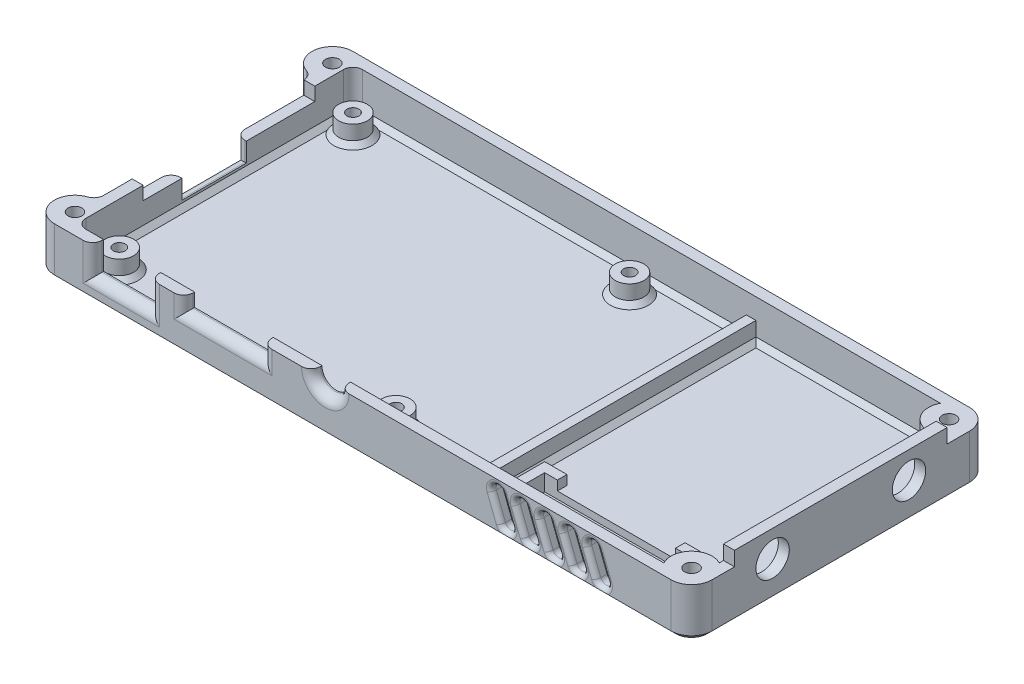
from build123d import *

# Parameters (mm, degrees)
SKETCH3_W                      = 133.6
SKETCH3_H                      = 62.6
SKETCH3_W_2                    = 129
SKETCH3_H_2                    = 58
BOSS_EXTRUDE1_DEPTH            = 10.3
SKETCH5_W                      = 129
SKETCH5_H                      = 58
BOSS_EXTRUDE2_DEPTH            = 2
SKETCH6_R                      = 3
BOSS_EXTRUDE3_DEPTH            = 4
F_2_5_2_5_DIAMETER_HOLE1_D     = 2.5
F_2_5_2_5_DIAMETER_HOLE1_DEPTH = 8
F_2_5_2_5_DIAMETER_HOLE1_TIP   = 0.751075774
SKETCH10_W                     = 2
SKETCH10_H                     = 58
BOSS_EXTRUDE4_DEPTH            = 4
CUT_EXTRUDE1_REACH             = 100.128
SKETCH11_R                     = 3
SKETCH11_W                     = 12
SKETCH11_H                     = 5.8
SKETCH11_W_2                   = 16.5
SKETCH11_H_2                   = 2.8
CUT_EXTRUDE2_REACH             = 140.343
SKETCH12_W                     = 13.5
SKETCH12_H                     = 6.8
SKETCH12_W_2                   = 36
SKETCH12_H_2                   = 2.8
FILLET6_R                      = 2
FILLET8_R                      = 2
CHAMFER1_SIZE                  = 1
FILLET9_R                      = 2
BOSS_EXTRUDE6_DEPTH            = 10.3
F_2_9_2_9_DIAMETER_HOLE2_D     = 2.9
F_2_9_2_9_DIAMETER_HOLE1_D     = 2.9
SKETCH24_R                     = 4.3
BOSS_EXTRUDE7_DEPTH            = 8.3
F_2_9_2_9_DIAMETER_HOLE5_D     = 2.9
F_2_9_2_9_DIAMETER_HOLE4_D     = 2.9
FILLET10_R                     = 4.3
FILLET18_R                     = 2
CHAMFER3_SIZE                  = 1
FILLET19_R                     = 2
FILLET20_R                     = 4.3
CHAMFER6_SIZE                  = 1
SKETCH29_W                     = 2.3
SKETCH29_H                     = 44.6
BOSS_EXTRUDE8_DEPTH            = 3
CUT_EXTRUDE3_REACH             = 166.847
SKETCH13_R                     = 3.5
SKETCH32_W                     = 30.1
SKETCH32_H                     = 10.2
CUT_EXTRUDE4_DEPTH             = 1.5
BOSS_EXTRUDE9_DEPTH            = 2
CUT_EXTRUDE5_REACH             = 103.795
FILLET21_R                     = 1
CHAMFER7_SIZE                  = 1


# Some blends are built 0.0001 mm under size
with BuildPart() as part:
    # Sketch3 → Boss-Extrude1 (new body)
    with BuildSketch(Plane(origin=(0, 0, 0), x_dir=(1, 0, 0), z_dir=(0, 1, 0))):
        with Locations((-8.061766162, 3.105993834)):
            Rectangle(SKETCH3_W, SKETCH3_H)
        with Locations((-8.061766162, 3.105993834)):
            Rectangle(SKETCH3_W_2, SKETCH3_H_2, mode=Mode.SUBTRACT)
    extrude(amount=BOSS_EXTRUDE1_DEPTH)

    # Sketch5 → Boss-Extrude2 (add)
    with BuildSketch(Plane(origin=(0, 0, 0), x_dir=(1, 0, 0), z_dir=(0, 1, 0))):
        with Locations((-8.061766162, 3.105993834)):
            Rectangle(SKETCH5_W, SKETCH5_H)
    extrude(amount=BOSS_EXTRUDE2_DEPTH)

    # Sketch6 → Boss-Extrude3 (add)
    with BuildSketch(Plane(origin=(0, 2, 0), x_dir=(1, 0, 0), z_dir=(0, 1, 0))):
        with Locations(Location((-68.061766162, 27.605993834, 0), (0, 0, 270))):
            Circle(SKETCH6_R)
        with Locations(Location((-68.061766162, -21.394006166, 0), (0, 0, 270))):
            Circle(SKETCH6_R)
        with Locations(Location((-10.061766162, -21.394006166, 0), (0, 0, 270))):
            Circle(SKETCH6_R)
        with Locations(Location((-10.061766162, 27.605993834, 0), (0, 0, 270))):
            Circle(SKETCH6_R)
    extrude(amount=BOSS_EXTRUDE3_DEPTH)

    # Ø2.5 (2.5) Diameter Hole1
    with Locations(Plane(origin=(0, 6, 0), x_dir=(1, 0, 0), z_dir=(0, 1, 0))):
        with Locations((-68.061766162, 27.605993834), (-10.061766162, 27.605993834), (-10.061766162, -21.394006166), (-68.061766162, -21.394006166)):
            Hole(F_2_5_2_5_DIAMETER_HOLE1_D / 2, depth=F_2_5_2_5_DIAMETER_HOLE1_DEPTH)
            with Locations((0, 0, -(F_2_5_2_5_DIAMETER_HOLE1_DEPTH + F_2_5_2_5_DIAMETER_HOLE1_TIP / 2))):  # 118° drill point
                Cone(0, F_2_5_2_5_DIAMETER_HOLE1_D / 2, F_2_5_2_5_DIAMETER_HOLE1_TIP, mode=Mode.SUBTRACT)

    # Sketch10 → Boss-Extrude4 (add)
    with BuildSketch(Plane(origin=(0, 2, 0), x_dir=(1, 0, 0), z_dir=(0, 1, 0))):
        with Locations((10.938233838, 3.105993834)):
            Rectangle(SKETCH10_W, SKETCH10_H)
    extrude(amount=BOSS_EXTRUDE4_DEPTH)

    # Sketch11 → Cut-Extrude1 (cut, up to next)
    with BuildSketch(Plane.XY.offset(28.194006166), mode=Mode.PRIVATE) as cut_extrude1_sk1:
        with Locations((-18.061766162, 10.3)):
            Circle(SKETCH11_R)
    cut_extrude1_tool1 = extrude(cut_extrude1_sk1.sketch, amount=-CUT_EXTRUDE1_REACH, mode=Mode.PRIVATE) & part.part
    # Sketch11 → Cut-Extrude1 (cut, up to next)
    with BuildSketch(Plane.XY.offset(28.194006166), mode=Mode.PRIVATE) as cut_extrude1_sk2:
        with Locations((-60.861766162, 7.4)):
            Rectangle(SKETCH11_W, SKETCH11_H)
    cut_extrude1_tool2 = extrude(cut_extrude1_sk2.sketch, amount=-CUT_EXTRUDE1_REACH, mode=Mode.PRIVATE) & part.part
    # Sketch11 → Cut-Extrude1 (cut, up to next)
    with BuildSketch(Plane.XY.offset(28.194006166), mode=Mode.PRIVATE) as cut_extrude1_sk3:
        with Locations((-39.527982648, 8.9)):
            Rectangle(SKETCH11_W_2, SKETCH11_H_2)
    cut_extrude1_tool3 = extrude(cut_extrude1_sk3.sketch, amount=-CUT_EXTRUDE1_REACH, mode=Mode.PRIVATE) & part.part
    add(cut_extrude1_tool1.solids().sort_by_distance((-18.061766, 10.3, 28.194006))[0], mode=Mode.SUBTRACT)
    add(cut_extrude1_tool2.solids().sort_by_distance((-60.861766, 7.4, 28.194006))[0], mode=Mode.SUBTRACT)
    add(cut_extrude1_tool3.solids().sort_by_distance((-39.527983, 8.9, 28.194006))[0], mode=Mode.SUBTRACT)

    # Sketch12 → Cut-Extrude2 (cut, up to next)
    with BuildSketch(Plane.ZY.offset(74.861766162), mode=Mode.PRIVATE) as cut_extrude2_sk1:
        with Locations((-2.982922372, 6.9)):
            Rectangle(SKETCH12_W, SKETCH12_H)
    cut_extrude2_tool1 = extrude(cut_extrude2_sk1.sketch, amount=-CUT_EXTRUDE2_REACH, mode=Mode.PRIVATE) & part.part
    # Sketch12 → Cut-Extrude2 (cut, up to next)
    with BuildSketch(Plane.ZY.offset(74.861766162), mode=Mode.PRIVATE) as cut_extrude2_sk2:
        with Locations((-6.105993834, 8.9)):
            Rectangle(SKETCH12_W_2, SKETCH12_H_2)
    cut_extrude2_tool2 = extrude(cut_extrude2_sk2.sketch, amount=-CUT_EXTRUDE2_REACH, mode=Mode.PRIVATE) & part.part
    add(cut_extrude2_tool1.solids().sort_by_distance((-74.861766, 6.9, -2.982922))[0], mode=Mode.SUBTRACT)
    add(cut_extrude2_tool2.solids().sort_by_distance((-74.861766, 8.9, -6.105994))[0], mode=Mode.SUBTRACT)

    # Fillet6
    fillet6_edges = [part.edges().sort_by_distance(p)[0] for p in [
        (56.438233838, 6.15, -32.105993834),
    ]]
    fillet(fillet6_edges, radius=FILLET6_R)

    # Fillet8
    fillet8_edges = [part.edges().sort_by_distance(p)[0] for p in [
        (-72.561766162, 6.15, -32.105993834),
        (-72.561766162, 6.15, 25.894006166),
    ]]
    fillet(fillet8_edges, radius=FILLET8_R)

    # Chamfer1
    chamfer1_edges = [part.edges().sort_by_distance(p)[0] for p in [
        (-68.061766162, 2, -30.605993834),
        (-68.061766162, 2, 18.394006166),
        (-10.061766162, 2, 18.394006166),
        (-10.061766162, 2, -30.605993834),
    ]]
    chamfer(chamfer1_edges, length=CHAMFER1_SIZE)

    # Fillet9
    fillet9_edges = [part.edges().sort_by_distance(p)[0] for p in [
        (-60.861766162, 4.5, 28.194006166),
        (-54.861766162, 7.4, 28.194006166),
        (-47.777982648, 8.9, 28.194006166),
        (-39.527982648, 7.5, 28.194006166),
        (-31.277982648, 8.9, 28.194006166),
        (-18.061766162, 7.3, 28.194006166),
        (-74.861766162, 5.5, -9.732922372),
        (-74.861766162, 3.5, -2.982922372),
        (-74.861766162, 5.5, 3.767077628),
    ]]
    fillet(fillet9_edges, radius=FILLET9_R)

    # Sketch17 → Boss-Extrude6 (add)
    with BuildSketch(Plane(origin=(0, 0, 0), x_dir=(1, 0, 0), z_dir=(0, 1, 0))):
        with BuildLine():
            Line((-74.861766162, 34.405993834), (-74.861766162, 25.805993834))
            ThreePointArc((-74.861766162, 25.805993834), (-79.161766162, 30.105993834), (-74.861766162, 34.405993834))
        make_face()
        with BuildLine():
            Line((-74.861766162, -19.594006166), (-74.861766162, -28.194006166))
            ThreePointArc((-74.861766162, -28.194006166), (-79.161766162, -23.894006166), (-74.861766162, -19.594006166))
        make_face()
    extrude(amount=BOSS_EXTRUDE6_DEPTH)

    # Ø2.9 (2.9) Diameter Hole2 (through all)
    with Locations(Plane(origin=(0, 10.3, 0), x_dir=(1, 0, 0), z_dir=(0, 1, 0))):
        with Locations((-74.861766162, 30.105993834)):
            Hole(F_2_9_2_9_DIAMETER_HOLE2_D / 2)

    # Ø2.9 (2.9) Diameter Hole1 (through all)
    with Locations(Plane(origin=(0, 10.3, 0), x_dir=(1, 0, 0), z_dir=(0, 1, 0))):
        with Locations((-74.861766162, -23.894006166)):
            Hole(F_2_9_2_9_DIAMETER_HOLE1_D / 2)

    # Sketch24 → Boss-Extrude7 (add)
    with BuildSketch(Plane(origin=(0, 2, 0), x_dir=(1, 0, 0), z_dir=(0, 1, 0))):
        with Locations((54.438233838, -23.894006166)):
            Circle(SKETCH24_R)
        with Locations((54.438233838, 30.105993834)):
            Circle(SKETCH24_R)
    extrude(amount=BOSS_EXTRUDE7_DEPTH)

    # Ø2.9 (2.9) Diameter Hole5 (through all)
    with Locations(Plane(origin=(0, 10.3, 0), x_dir=(1, 0, 0), z_dir=(0, 1, 0))):
        with Locations((54.438233838, -23.894006166)):
            Hole(F_2_9_2_9_DIAMETER_HOLE5_D / 2)

    # Ø2.9 (2.9) Diameter Hole4 (through all)
    with Locations(Plane(origin=(0, 10.3, 0), x_dir=(1, 0, 0), z_dir=(0, 1, 0))):
        with Locations((54.438233838, 30.105993834)):
            Hole(F_2_9_2_9_DIAMETER_HOLE4_D / 2)

    # Fillet10
    fillet10_edges = [part.edges().sort_by_distance(p)[0] for p in [
        (58.738233838, 5.15, -34.405993834),
    ]]
    fillet(fillet10_edges, radius=FILLET10_R - 0.0001)  # a hair under: the kernel refuses the full size

    # Fillet18
    fillet18_edges = [part.edges().sort_by_distance(p)[0] for p in [
        (-74.861766162, 5.15, -25.805993834),
        (-74.861766162, 5.15, 19.594006166),
    ]]
    fillet(fillet18_edges, radius=FILLET18_R)

    # Chamfer3
    chamfer3_edges = [part.edges().sort_by_distance(p)[0] for p in [
        (-79.105793795, 0, -30.797535193),
        (-10.211716162, 0, -34.405993834),
        (57.478822286, 0, -33.146582283),
        (-79.105793795, 0, 24.585547524),
        (-74.861766162, 0, -3.105993834),
        (-75.2385223, 0, 19.088261462),
        (-75.2385223, 0, -25.300249131),
        (58.738233838, 0, -0.956043834),
        (-8.061766162, 0, 28.194006166),
    ]]
    chamfer(chamfer3_edges, length=CHAMFER3_SIZE)

    # Fillet19
    fillet19_edges = [part.edges().sort_by_distance(p)[0] for p in [
        (-66.861766162, 6.4, 28.194006166),
    ]]
    fillet(fillet19_edges, radius=FILLET19_R)

    # Fillet20
    # the kernel refuses this fillet: 4.3 mm, written as the material it takes off along each edge
    with BuildSketch(Plane(origin=(58.738233838, -9.75, 28.194006166), x_dir=(-1, 0, 0), z_dir=(0, 1, 0))) as fillet20_piece_1:
        with BuildLine():
            CenterArc((FILLET20_R, -FILLET20_R), FILLET20_R, 90, 90)
            Line((0, -FILLET20_R), (0, 0))
            Line((0, 0), (FILLET20_R, 0))
        make_face()
    extrude(amount=30.8, mode=Mode.SUBTRACT)

    # Chamfer5
    # the kernel refuses this chamfer: 1 mm, written as the material it adds along each edge
    with BuildSketch(Plane(origin=(-72.561766162, 2, 23.894006166), x_dir=(-0.027495876610568366, 0.9996219169112972, 0), z_dir=(0, 0, -1))) as chamfer5_piece_1:
        with BuildLine():
            Line((1.028673195, 0), (-0.056547155, 1.027117794))
            Line((-0.056547155, 1.027117794), (-0.076539593, 1.026567876))
            ThreePointArc((-0.076539593, 1.026567876), (-0.034129227, 0.51339783), (-0.019992438, -0.000549918))
            Line((-0.019992438, -0.000549918), (0.000549918, -0.019992438))
            ThreePointArc((0.000549918, -0.019992438), (0.514497665, -0.00585565), (1.029223113, -0.019992438))
            Line((1.029223113, -0.019992438), (1.028673195, 0))
        make_face()
    extrude(amount=54)
    with BuildSketch(Plane(origin=(-70.561766162, 2, 23.894006166), x_dir=(0, 0, 1), z_dir=(1, 0, 0))) as chamfer5_piece_2:
        with BuildLine():
            Line((0.971715729, 0.028284271), (2.028284271, -1.028284271))
            Line((2.028284271, -1.028284271), (2.048284271, -1.028284271))
            ThreePointArc((2.048284271, -1.028284271), (2.02, -0.514142136), (2.02, 0))
            Line((2.02, 0), (2, 0.02))
            ThreePointArc((2, 0.02), (1.485857864, 0.02), (0.971715729, 0.048284271))
            Line((0.971715729, 0.048284271), (0.971715729, 0.028284271))
        make_face()
    revolve(axis=Axis((-70.561766162, 2, 23.894006166), (0, -1, 0)), revolution_arc=90)
    with BuildSketch(Plane(origin=(-70.561766162, 2, -30.105993834), x_dir=(0, 0, -1), z_dir=(1, 0, 0))) as chamfer5_piece_3:
        with BuildLine():
            Line((2.028284271, 1.028284271), (0.971715729, -0.028284271))
            Line((0.971715729, -0.028284271), (0.971715729, -0.048284271))
            ThreePointArc((0.971715729, -0.048284271), (1.485857864, -0.02), (2, -0.02))
            Line((2, -0.02), (2.02, 0))
            ThreePointArc((2.02, 0), (2.02, 0.514142136), (2.048284271, 1.028284271))
            Line((2.048284271, 1.028284271), (2.028284271, 1.028284271))
        make_face()
    revolve(axis=Axis((-70.561766162, 2, -30.105993834), (0, 1, 0)), revolution_arc=90)
    with BuildSketch(Plane(origin=(9.938233838, 2, 25.894006166), x_dir=(0, 0.999621916911297, 0.027495876610582174), z_dir=(-1, 0, 0)), Plane(origin=(-70.561766162, 2, -32.105993834), x_dir=(0, 0.9996219169112968, -0.027495876610589075), z_dir=(1, 0, 0))) as chamfer5_piece_4:
        with BuildLine():
            Line((1.028673195, 0), (-0.056547155, 1.027117794))
            Line((-0.056547155, 1.027117794), (-0.076539593, 1.026567876))
            ThreePointArc((-0.076539593, 1.026567876), (-0.034129227, 0.51339783), (-0.019992438, -0.000549918))
            Line((-0.019992438, -0.000549918), (0.000549918, -0.019992438))
            ThreePointArc((0.000549918, -0.019992438), (0.514497665, -0.00585565), (1.029223113, -0.019992438))
            Line((1.029223113, -0.019992438), (1.028673195, 0))
        make_face()
    extrude(amount=80.5)
    with BuildSketch(Plane(origin=(9.938233838, 2, 25.894006166), x_dir=(0.027495876610585623, 0.9996219169112968, 0), z_dir=(0, 0, -1)), Plane(origin=(11.938233838, 2, -32.105993834), x_dir=(-0.027495876610585623, 0.9996219169112968, 0), z_dir=(0, 0, 1))) as chamfer5_piece_5:
        with BuildLine():
            Line((1.028673195, 0), (-0.056547155, -1.027117794))
            Line((-0.056547155, -1.027117794), (-0.076539593, -1.026567876))
            ThreePointArc((-0.076539593, -1.026567876), (-0.034129227, -0.51339783), (-0.019992438, 0.000549918))
            Line((-0.019992438, 0.000549918), (0.000549918, 0.019992438))
            ThreePointArc((0.000549918, 0.019992438), (0.514497665, 0.00585565), (1.029223113, 0.019992438))
            Line((1.029223113, 0.019992438), (1.028673195, 0))
        make_face()
    extrude(amount=58)
    with BuildSketch(Plane(origin=(11.938233838, 2, -32.105993834), x_dir=(0, 0.999621916911297, -0.027495876610582174), z_dir=(1, 0, 0))) as chamfer5_piece_6_section:
        with BuildLine():
            Line((1.028673195, 0), (-0.056547155, 1.027117794))
            Line((-0.056547155, 1.027117794), (-0.076539593, 1.026567876))
            ThreePointArc((-0.076539593, 1.026567876), (-0.034129227, 0.51339783), (-0.019992438, -0.000549918))
            Line((-0.019992438, -0.000549918), (0.000549918, -0.019992438))
            ThreePointArc((0.000549918, -0.019992438), (0.514497665, -0.00585565), (1.029223113, -0.019992438))
            Line((1.029223113, -0.019992438), (1.028673195, 0))
        make_face()
    chamfer5_piece_6 = extrude(amount=41.265109726, mode=Mode.PRIVATE)
    chamfer5_piece_6 = chamfer5_piece_6 - Plane(origin=(54.438233838, 2.330149523, -30.105993834), x_dir=(1, 0, 0), z_dir=(0, -1, 0)) * Cylinder(4.3, 87, mode=Mode.PRIVATE)
    add(chamfer5_piece_6)
    with BuildSketch(Plane(origin=(9.938233838, 2, 28.465689154), x_dir=(0.027495876610585623, 0.9996219169112968, 0), z_dir=(0, 0, -1))) as chamfer5_piece_7a_section:
        with BuildLine():
            Line((1.028673195, 0), (-0.056547155, -1.027117794))
            Line((-0.056547155, -1.027117794), (-0.076539593, -1.026567876))
            ThreePointArc((-0.076539593, -1.026567876), (-0.034129227, -0.51339783), (-0.019992438, 0.000549918))
            Line((-0.019992438, 0.000549918), (0.000549918, 0.019992438))
            ThreePointArc((0.000549918, 0.019992438), (0.514497665, 0.00585565), (1.029223113, 0.019992438))
            Line((1.029223113, 0.019992438), (1.028673195, 0))
        make_face()
    chamfer5_piece_7a = extrude(amount=60.571682988, mode=Mode.PRIVATE)
    chamfer5_piece_7a = split(chamfer5_piece_7a, bisect_by=Plane(origin=(9.608440211, 2.329793627, 25.894006166), z_dir=(0, 0, 1)), keep=Keep.TOP, mode=Mode.PRIVATE)
    with BuildSketch(Plane(origin=(12.509916826, 2, 25.894006166), x_dir=(0, 0.9996219169112968, 0.027495876610585623), z_dir=(-1, 0, 0))) as chamfer5_piece_7b_section:
        with BuildLine():
            Line((1.028673195, 0), (-0.056547155, 1.027117794))
            Line((-0.056547155, 1.027117794), (-0.076539593, 1.026567876))
            ThreePointArc((-0.076539593, 1.026567876), (-0.034129227, 0.51339783), (-0.019992438, -0.000549918))
            Line((-0.019992438, -0.000549918), (0.000549918, -0.019992438))
            ThreePointArc((0.000549918, -0.019992438), (0.514497665, -0.00585565), (1.029223113, -0.019992438))
            Line((1.029223113, -0.019992438), (1.028673195, 0))
        make_face()
    chamfer5_piece_7b = extrude(amount=83.071682988, mode=Mode.PRIVATE)
    chamfer5_piece_7b = split(chamfer5_piece_7b, bisect_by=Plane(origin=(9.938233838, 2.329793627, 25.564212539), z_dir=(1, 0, 0)), keep=Keep.TOP, mode=Mode.PRIVATE)
    chamfer5_piece_7 = chamfer5_piece_7a & chamfer5_piece_7b
    add(chamfer5_piece_7)
    with BuildSketch(Plane(origin=(-70.561766162, 2, -32.105993834), x_dir=(0, 0.9996219169112968, -0.027495876610589075), z_dir=(1, 0, 0))) as chamfer5_piece_8a_section:
        with BuildLine():
            Line((1.028673195, 0), (-0.056547155, 1.027117794))
            Line((-0.056547155, 1.027117794), (-0.076539593, 1.026567876))
            ThreePointArc((-0.076539593, 1.026567876), (-0.034129227, 0.51339783), (-0.019992438, -0.000549918))
            Line((-0.019992438, -0.000549918), (0.000549918, -0.019992438))
            ThreePointArc((0.000549918, -0.019992438), (0.514497665, -0.00585565), (1.029223113, -0.019992438))
            Line((1.029223113, -0.019992438), (1.028673195, 0))
        make_face()
    chamfer5_piece_8a = extrude(amount=83.071682988, mode=Mode.PRIVATE)
    chamfer5_piece_8a = split(chamfer5_piece_8a, bisect_by=Plane(origin=(9.938233838, 2.329793627, -31.776200208), z_dir=(1, 0, 0)), keep=Keep.TOP, mode=Mode.PRIVATE)
    with BuildSketch(Plane(origin=(9.938233838, 2, 25.894006166), x_dir=(0.027495876610585623, 0.9996219169112968, 0), z_dir=(0, 0, -1))) as chamfer5_piece_8b_section:
        with BuildLine():
            Line((1.028673195, 0), (-0.056547155, -1.027117794))
            Line((-0.056547155, -1.027117794), (-0.076539593, -1.026567876))
            ThreePointArc((-0.076539593, -1.026567876), (-0.034129227, -0.51339783), (-0.019992438, 0.000549918))
            Line((-0.019992438, 0.000549918), (0.000549918, 0.019992438))
            ThreePointArc((0.000549918, 0.019992438), (0.514497665, 0.00585565), (1.029223113, 0.019992438))
            Line((1.029223113, 0.019992438), (1.028673195, 0))
        make_face()
    chamfer5_piece_8b = extrude(amount=60.571682988, mode=Mode.PRIVATE)
    chamfer5_piece_8b = split(chamfer5_piece_8b, bisect_by=Plane(origin=(9.608440211, 2.329793627, -32.105993834), z_dir=(0, 0, -1)), keep=Keep.TOP, mode=Mode.PRIVATE)
    chamfer5_piece_8 = chamfer5_piece_8a & chamfer5_piece_8b
    add(chamfer5_piece_8)
    with BuildSketch(Plane(origin=(9.36655085, 2, -32.105993834), x_dir=(0, 0.9996219169112968, -0.027495876610589075), z_dir=(1, 0, 0))) as chamfer5_piece_9a_section:
        with BuildLine():
            Line((1.028673195, 0), (-0.056547155, 1.027117794))
            Line((-0.056547155, 1.027117794), (-0.076539593, 1.026567876))
            ThreePointArc((-0.076539593, 1.026567876), (-0.034129227, 0.51339783), (-0.019992438, -0.000549918))
            Line((-0.019992438, -0.000549918), (0.000549918, -0.019992438))
            ThreePointArc((0.000549918, -0.019992438), (0.514497665, -0.00585565), (1.029223113, -0.019992438))
            Line((1.029223113, -0.019992438), (1.028673195, 0))
        make_face()
    chamfer5_piece_9a = extrude(amount=43.836792714, mode=Mode.PRIVATE)
    chamfer5_piece_9a = split(chamfer5_piece_9a, bisect_by=Plane(origin=(11.938233838, 2.329793627, -31.776200208), z_dir=(-1, 0, 0)), keep=Keep.TOP, mode=Mode.PRIVATE)
    with BuildSketch(Plane(origin=(11.938233838, 2, -34.677676822), x_dir=(-0.027495876610585623, 0.9996219169112968, 0), z_dir=(0, 0, 1))) as chamfer5_piece_9b_section:
        with BuildLine():
            Line((1.028673195, 0), (-0.056547155, -1.027117794))
            Line((-0.056547155, -1.027117794), (-0.076539593, -1.026567876))
            ThreePointArc((-0.076539593, -1.026567876), (-0.034129227, -0.51339783), (-0.019992438, 0.000549918))
            Line((-0.019992438, 0.000549918), (0.000549918, 0.019992438))
            ThreePointArc((0.000549918, 0.019992438), (0.514497665, 0.00585565), (1.029223113, 0.019992438))
            Line((1.029223113, 0.019992438), (1.028673195, 0))
        make_face()
    chamfer5_piece_9b = extrude(amount=60.571682988, mode=Mode.PRIVATE)
    chamfer5_piece_9b = split(chamfer5_piece_9b, bisect_by=Plane(origin=(12.268027465, 2.329793627, -32.105993834), z_dir=(0, 0, -1)), keep=Keep.TOP, mode=Mode.PRIVATE)
    chamfer5_piece_9 = chamfer5_piece_9a & chamfer5_piece_9b
    add(chamfer5_piece_9)

    # Chamfer6
    chamfer6_edges = [part.edges().sort_by_distance(p)[0] for p in [
        (56.438233838, 2, -3.105993834),
    ]]
    chamfer(chamfer6_edges, length=CHAMFER6_SIZE)

    # Sketch29 → Boss-Extrude8 (add)
    with BuildSketch(Plane(origin=(0, 10.3, 0), x_dir=(1, 0, 0), z_dir=(0, 1, 0))):
        with Locations((57.588233838, 3.105993834)):
            Rectangle(SKETCH29_W, SKETCH29_H)
    extrude(amount=BOSS_EXTRUDE8_DEPTH)

    # Sketch13 → Cut-Extrude3 (cut, up to next)
    with BuildSketch(Plane(origin=(58.738233838, 0, -61.144227672), x_dir=(0, 0, -1), z_dir=(1, 0, 0)), mode=Mode.PRIVATE) as cut_extrude3_sk1:
        with Locations((-72.338233838, 7.722271929)):
            Circle(SKETCH13_R)
    cut_extrude3_tool1 = extrude(cut_extrude3_sk1.sketch, amount=-CUT_EXTRUDE3_REACH, mode=Mode.PRIVATE) & part.part
    # Sketch13 → Cut-Extrude3 (cut, up to next)
    with BuildSketch(Plane(origin=(58.738233838, 0, -61.144227672), x_dir=(0, 0, -1), z_dir=(1, 0, 0)), mode=Mode.PRIVATE) as cut_extrude3_sk2:
        with Locations((-43.738233838, 7.722271929)):
            Circle(SKETCH13_R)
    cut_extrude3_tool2 = extrude(cut_extrude3_sk2.sketch, amount=-CUT_EXTRUDE3_REACH, mode=Mode.PRIVATE) & part.part
    add(cut_extrude3_tool1.solids().sort_by_distance((58.738234, 7.722272, 11.194006))[0], mode=Mode.SUBTRACT)
    add(cut_extrude3_tool2.solids().sort_by_distance((58.738234, 7.722272, -17.405994))[0], mode=Mode.SUBTRACT)

    # Sketch32 → Cut-Extrude4 (cut)
    with BuildSketch(Plane(origin=(0, 2, 0), x_dir=(1, 0, 0), z_dir=(0, 1, 0))):
        with Locations((30.488233838, -20.794006166)):
            Rectangle(SKETCH32_W, SKETCH32_H)
    extrude(amount=-CUT_EXTRUDE4_DEPTH, mode=Mode.SUBTRACT)

    # Sketch33 → Boss-Extrude9 (add)
    with BuildSketch(Plane(origin=(0, 2, 0), x_dir=(1, 0, 0), z_dir=(0, 1, 0))):
        Polygon((15.438233838, -15.694006166), (15.438233838, -25.894006166), (13.438233838, -25.894006166), (13.438233838, -13.694006166), (18.108333222, -13.694006166), (18.108333222, -15.694006166), align=None)
        Polygon((47.538233838, -13.694006166), (47.538233838, -20.882174736), (45.538233838, -20.882174736), (45.538233838, -15.694006166), (42.868134454, -15.694006166), (42.868134454, -13.694006166), align=None)
    extrude(amount=BOSS_EXTRUDE9_DEPTH)

    # Sketch34 → Cut-Extrude5 (cut, up to next)
    with BuildSketch(Plane.XY.offset(28.194006166), mode=Mode.PRIVATE) as cut_extrude5_sk1:
        with BuildLine():
            Line((19.140183986, 8.196301764), (21.05650073, 3.254871795))
            ThreePointArc((21.05650073, 3.254871795), (20.34303063, 1.637478703), (18.725637537, 2.350948803))
            Line((18.725637537, 2.350948803), (16.809320793, 7.292378772))
            ThreePointArc((16.809320793, 7.292378772), (17.522790894, 8.909771864), (19.140183986, 8.196301764))
        make_face()
    cut_extrude5_tool1 = extrude(cut_extrude5_sk1.sketch, amount=-CUT_EXTRUDE5_REACH, mode=Mode.PRIVATE) & part.part
    # Sketch34 → Cut-Extrude5 (cut, up to next)
    with BuildSketch(Plane.XY.offset(28.194006166), mode=Mode.PRIVATE) as cut_extrude5_sk2:
        with BuildLine():
            Line((24.140183986, 8.196301764), (26.05650073, 3.254871795))
            ThreePointArc((26.05650073, 3.254871795), (25.34303063, 1.637478703), (23.725637537, 2.350948803))
            Line((23.725637537, 2.350948803), (21.809320793, 7.292378772))
            ThreePointArc((21.809320793, 7.292378772), (22.522790894, 8.909771864), (24.140183986, 8.196301764))
        make_face()
    cut_extrude5_tool2 = extrude(cut_extrude5_sk2.sketch, amount=-CUT_EXTRUDE5_REACH, mode=Mode.PRIVATE) & part.part
    # Sketch34 → Cut-Extrude5 (cut, up to next)
    with BuildSketch(Plane.XY.offset(28.194006166), mode=Mode.PRIVATE) as cut_extrude5_sk3:
        with BuildLine():
            Line((29.140183986, 8.196301764), (31.05650073, 3.254871795))
            ThreePointArc((31.05650073, 3.254871795), (30.34303063, 1.637478703), (28.725637537, 2.350948803))
            Line((28.725637537, 2.350948803), (26.809320793, 7.292378772))
            ThreePointArc((26.809320793, 7.292378772), (27.522790894, 8.909771864), (29.140183986, 8.196301764))
        make_face()
    cut_extrude5_tool3 = extrude(cut_extrude5_sk3.sketch, amount=-CUT_EXTRUDE5_REACH, mode=Mode.PRIVATE) & part.part
    # Sketch34 → Cut-Extrude5 (cut, up to next)
    with BuildSketch(Plane.XY.offset(28.194006166), mode=Mode.PRIVATE) as cut_extrude5_sk4:
        with BuildLine():
            Line((34.140183986, 8.196301764), (36.05650073, 3.254871795))
            ThreePointArc((36.05650073, 3.254871795), (35.34303063, 1.637478703), (33.725637537, 2.350948803))
            Line((33.725637537, 2.350948803), (31.809320793, 7.292378772))
            ThreePointArc((31.809320793, 7.292378772), (32.522790894, 8.909771864), (34.140183986, 8.196301764))
        make_face()
    cut_extrude5_tool4 = extrude(cut_extrude5_sk4.sketch, amount=-CUT_EXTRUDE5_REACH, mode=Mode.PRIVATE) & part.part
    # Sketch34 → Cut-Extrude5 (cut, up to next)
    with BuildSketch(Plane.XY.offset(28.194006166), mode=Mode.PRIVATE) as cut_extrude5_sk5:
        with BuildLine():
            Line((39.140183986, 8.196301764), (41.05650073, 3.254871795))
            ThreePointArc((41.05650073, 3.254871795), (40.34303063, 1.637478703), (38.725637537, 2.350948803))
            Line((38.725637537, 2.350948803), (36.809320793, 7.292378772))
            ThreePointArc((36.809320793, 7.292378772), (37.522790894, 8.909771864), (39.140183986, 8.196301764))
        make_face()
    cut_extrude5_tool5 = extrude(cut_extrude5_sk5.sketch, amount=-CUT_EXTRUDE5_REACH, mode=Mode.PRIVATE) & part.part
    add(cut_extrude5_tool1.solids().sort_by_distance((18.932911, 5.273625, 28.194006))[0], mode=Mode.SUBTRACT)
    add(cut_extrude5_tool2.solids().sort_by_distance((23.932911, 5.273625, 28.194006))[0], mode=Mode.SUBTRACT)
    add(cut_extrude5_tool3.solids().sort_by_distance((28.932911, 5.273625, 28.194006))[0], mode=Mode.SUBTRACT)
    add(cut_extrude5_tool4.solids().sort_by_distance((33.932911, 5.273625, 28.194006))[0], mode=Mode.SUBTRACT)
    add(cut_extrude5_tool5.solids().sort_by_distance((38.932911, 5.273625, 28.194006))[0], mode=Mode.SUBTRACT)

    # Fillet21
    # the kernel refuses this fillet: 1 mm, written as the material it takes off along each edge
    with BuildSketch(Plane(origin=(17.97475239, 7.744340268, 28.194006166), x_dir=(-0.9323452771444899, -0.3615691969545585, 0), z_dir=(0.3615691969545585, -0.9323452771444899, 0))) as fillet21_piece_1:
        with BuildLine():
            CenterArc((1.25 + FILLET21_R, FILLET21_R), FILLET21_R, 180, 90)
            Line((1.25 + FILLET21_R, 0), (1.25, 0))
            Line((1.25, 0), (1.25, FILLET21_R))
        make_face()
    revolve(axis=Axis((17.97475239, 7.744340268, 28.194006166), (0, 0, -1)), revolution_arc=180, mode=Mode.SUBTRACT)
    with BuildSketch(Plane(origin=(18.725637537, 2.350948803, 28.194006166), x_dir=(0, 0, -1), z_dir=(-0.36156919695456985, 0.9323452771444856, 0)), Plane(origin=(19.140183986, 8.196301764, 28.194006166), x_dir=(0, 0, -1), z_dir=(0.3615691969545619, -0.9323452771444886, 0)), Plane(origin=(23.725637537, 2.350948803, 28.194006166), x_dir=(0, 0, -1), z_dir=(-0.3615691969545605, 0.9323452771444891, 0)), Plane(origin=(24.140183986, 8.196301764, 28.194006166), x_dir=(0, 0, -1), z_dir=(0.3615691969545605, -0.9323452771444891, 0)), Plane(origin=(28.725637537, 2.350948803, 28.194006166), x_dir=(0, 0, -1), z_dir=(-0.3615691969545601, 0.9323452771444893, 0)), Plane(origin=(29.140183986, 8.196301764, 28.194006166), x_dir=(0, 0, -1), z_dir=(0.3615691969545628, -0.9323452771444882, 0)), Plane(origin=(33.725637537, 2.350948803, 28.194006166), x_dir=(0, 0, -1), z_dir=(-0.3615691969545628, 0.9323452771444882, 0)), Plane(origin=(34.140183986, 8.196301764, 28.194006166), x_dir=(0, 0, -1), z_dir=(0.3615691969545605, -0.9323452771444891, 0)), Plane(origin=(38.725637537, 2.350948803, 28.194006166), x_dir=(0, 0, -1), z_dir=(-0.3615691969545605, 0.9323452771444891, 0)), Plane(origin=(39.140183986, 8.196301764, 28.194006166), x_dir=(0, 0, -1), z_dir=(0.36156919695455964, -0.9323452771444896, 0))) as fillet21_piece_2:
        with BuildLine():
            CenterArc((FILLET21_R, FILLET21_R), FILLET21_R, 180, 90)
            Line((0, FILLET21_R), (0, 0))
            Line((0, 0), (FILLET21_R, 0))
        make_face()
    extrude(amount=5.3, mode=Mode.SUBTRACT)
    with BuildSketch(Plane(origin=(19.891069134, 2.802910299, 28.194006166), x_dir=(0.9323452771444968, 0.36156919695454104, 0), z_dir=(-0.36156919695454104, 0.9323452771444968, 0))) as fillet21_piece_3:
        with BuildLine():
            CenterArc((1.25 + FILLET21_R, FILLET21_R), FILLET21_R, 180, 90)
            Line((1.25 + FILLET21_R, 0), (1.25, 0))
            Line((1.25, 0), (1.25, FILLET21_R))
        make_face()
    revolve(axis=Axis((19.891069134, 2.802910299, 28.194006166), (0, 0, -1)), revolution_arc=180, mode=Mode.SUBTRACT)
    with BuildSketch(Plane(origin=(22.97475239, 7.744340268, 28.194006166), x_dir=(-0.9323452771444899, -0.3615691969545585, 0), z_dir=(0.3615691969545585, -0.9323452771444899, 0))) as fillet21_piece_4:
        with BuildLine():
            CenterArc((1.25 + FILLET21_R, FILLET21_R), FILLET21_R, 180, 90)
            Line((1.25 + FILLET21_R, 0), (1.25, 0))
            Line((1.25, 0), (1.25, FILLET21_R))
        make_face()
    revolve(axis=Axis((22.97475239, 7.744340268, 28.194006166), (0, 0, -1)), revolution_arc=180, mode=Mode.SUBTRACT)
    with BuildSketch(Plane(origin=(24.891069134, 2.802910299, 28.194006166), x_dir=(0.9323452771444884, 0.3615691969545626, 0), z_dir=(-0.3615691969545626, 0.9323452771444884, 0))) as fillet21_piece_5:
        with BuildLine():
            CenterArc((1.25 + FILLET21_R, FILLET21_R), FILLET21_R, 180, 90)
            Line((1.25 + FILLET21_R, 0), (1.25, 0))
            Line((1.25, 0), (1.25, FILLET21_R))
        make_face()
    revolve(axis=Axis((24.891069134, 2.802910299, 28.194006166), (0, 0, -1)), revolution_arc=180, mode=Mode.SUBTRACT)
    with BuildSketch(Plane(origin=(27.97475239, 7.744340268, 28.194006166), x_dir=(-0.9323452771444901, -0.36156919695455786, 0), z_dir=(0.36156919695455786, -0.9323452771444901, 0))) as fillet21_piece_6:
        with BuildLine():
            CenterArc((1.25 + FILLET21_R, FILLET21_R), FILLET21_R, 180, 90)
            Line((1.25 + FILLET21_R, 0), (1.25, 0))
            Line((1.25, 0), (1.25, FILLET21_R))
        make_face()
    revolve(axis=Axis((27.97475239, 7.744340268, 28.194006166), (0, 0, -1)), revolution_arc=180, mode=Mode.SUBTRACT)
    with BuildSketch(Plane(origin=(29.891069134, 2.802910299, 28.194006166), x_dir=(0.9323452771444861, 0.3615691969545684, 0), z_dir=(-0.3615691969545684, 0.9323452771444861, 0))) as fillet21_piece_7:
        with BuildLine():
            CenterArc((1.25 + FILLET21_R, FILLET21_R), FILLET21_R, 180, 90)
            Line((1.25 + FILLET21_R, 0), (1.25, 0))
            Line((1.25, 0), (1.25, FILLET21_R))
        make_face()
    revolve(axis=Axis((29.891069134, 2.802910299, 28.194006166), (0, 0, -1)), revolution_arc=180, mode=Mode.SUBTRACT)
    with BuildSketch(Plane(origin=(32.97475239, 7.744340268, 28.194006166), x_dir=(-0.9323452771444872, -0.36156919695456535, 0), z_dir=(0.36156919695456535, -0.9323452771444872, 0))) as fillet21_piece_8:
        with BuildLine():
            CenterArc((1.25 + FILLET21_R, FILLET21_R), FILLET21_R, 180, 90)
            Line((1.25 + FILLET21_R, 0), (1.25, 0))
            Line((1.25, 0), (1.25, FILLET21_R))
        make_face()
    revolve(axis=Axis((32.97475239, 7.744340268, 28.194006166), (0, 0, -1)), revolution_arc=180, mode=Mode.SUBTRACT)
    with BuildSketch(Plane(origin=(34.891069134, 2.802910299, 28.194006166), x_dir=(0.9323452771444815, 0.36156919695458034, 0), z_dir=(-0.36156919695458034, 0.9323452771444815, 0))) as fillet21_piece_9:
        with BuildLine():
            CenterArc((1.25 + FILLET21_R, FILLET21_R), FILLET21_R, 180, 90)
            Line((1.25 + FILLET21_R, 0), (1.25, 0))
            Line((1.25, 0), (1.25, FILLET21_R))
        make_face()
    revolve(axis=Axis((34.891069134, 2.802910299, 28.194006166), (0, 0, -1)), revolution_arc=180, mode=Mode.SUBTRACT)
    with BuildSketch(Plane(origin=(37.97475239, 7.744340268, 28.194006166), x_dir=(-0.9323452771444841, -0.3615691969545735, 0), z_dir=(0.3615691969545735, -0.9323452771444841, 0))) as fillet21_piece_10:
        with BuildLine():
            CenterArc((1.25 + FILLET21_R, FILLET21_R), FILLET21_R, 180, 90)
            Line((1.25 + FILLET21_R, 0), (1.25, 0))
            Line((1.25, 0), (1.25, FILLET21_R))
        make_face()
    revolve(axis=Axis((37.97475239, 7.744340268, 28.194006166), (0, 0, -1)), revolution_arc=180, mode=Mode.SUBTRACT)
    with BuildSketch(Plane(origin=(39.891069134, 2.802910299, 28.194006166), x_dir=(0.9323452771444932, 0.36156919695455003, 0), z_dir=(-0.36156919695455003, 0.9323452771444932, 0))) as fillet21_piece_11:
        with BuildLine():
            CenterArc((1.25 + FILLET21_R, FILLET21_R), FILLET21_R, 180, 90)
            Line((1.25 + FILLET21_R, 0), (1.25, 0))
            Line((1.25, 0), (1.25, FILLET21_R))
        make_face()
    revolve(axis=Axis((39.891069134, 2.802910299, 28.194006166), (0, 0, -1)), revolution_arc=180, mode=Mode.SUBTRACT)

    # Chamfer7
    chamfer7_edges = [part.edges().sort_by_distance(p)[0] for p in [
        (57.478792997, 0, 26.934565325),
    ]]
    chamfer(chamfer7_edges, length=CHAMFER7_SIZE - 0.0001)  # a hair under: the kernel refuses the full size


solid = part.part
